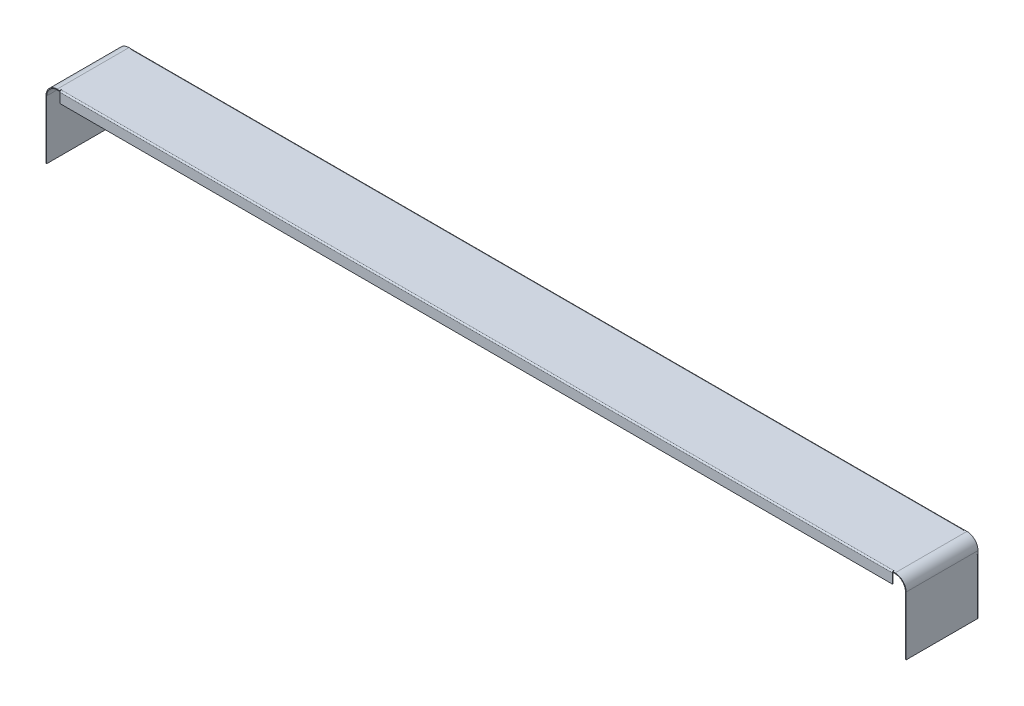
from build123d import *

# Parameters (mm, degrees)
BASE_FLANGE1_DEPTH            = 104
EDGE_FLANGE1_STRIP_W          = 6
EDGE_FLANGE1_STRIP_H          = 1
EDGE_FLANGE1_STRIP_CUT_DEPTH  = 1204
EDGE_FLANGE1_RELIEF_W         = 6.5
EDGE_FLANGE1_RELIEF_H         = 0.5
EDGE_FLANGE1_RELIEF_CUT_DEPTH = 1
EDGE_FLANGE1_DEPTH            = 1204
EDGE_FLANGE2_STRIP_W          = 6
EDGE_FLANGE2_STRIP_H          = 1
EDGE_FLANGE2_STRIP_CUT_DEPTH  = 1204
EDGE_FLANGE2_DEPTH            = 1204
EDGE_FLANGE3_STRIP_W          = 6
EDGE_FLANGE3_STRIP_H          = 1
EDGE_FLANGE3_STRIP_CUT_DEPTH  = 80
EDGE_FLANGE3_RELIEF_W         = 6.5
EDGE_FLANGE3_RELIEF_H         = 0.5
EDGE_FLANGE3_RELIEF_CUT_DEPTH = 1
EDGE_FLANGE3_DEPTH            = 80
EDGE_FLANGE4_STRIP_W          = 6
EDGE_FLANGE4_STRIP_H          = 1
EDGE_FLANGE4_STRIP_CUT_DEPTH  = 80
EDGE_FLANGE4_DEPTH            = 80
EDGE_FLANGE5_STRIP_W          = 6
EDGE_FLANGE5_STRIP_H          = 1
EDGE_FLANGE5_STRIP_CUT_DEPTH  = 1204
EDGE_FLANGE5_RELIEF_W         = 6.5
EDGE_FLANGE5_RELIEF_H         = 0.5
EDGE_FLANGE5_RELIEF_CUT_DEPTH = 1
EDGE_FLANGE5_DEPTH            = 1204


# Sheet-metal steps are written as plain solids
with BuildPart() as part:
    # Sketch1 → Base-Flange1 (new body)
    with BuildSketch(Plane.XY):
        with BuildLine():
            Line((-621, -100), (-621, -15))
            ThreePointArc((-621, -15), (-616.606601718, -4.393398282), (-606, 0))
            Line((-606, 0), (606, 0))
            ThreePointArc((606, 0), (616.606601718, -4.393398282), (621, -15))
            Line((621, -15), (621, -100))
            Line((621, -100), (622, -100))
            Line((622, -100), (622, -15))
            ThreePointArc((622, -15), (617.313708499, -3.686291501), (606, 1))
            Line((606, 1), (-606, 1))
            ThreePointArc((-606, 1), (-617.313708499, -3.686291501), (-622, -15))
            Line((-622, -15), (-622, -100))
            Line((-622, -100), (-621, -100))
        make_face()
    extrude(amount=BASE_FLANGE1_DEPTH)

    # Edge-Flange1 strip (across the edge) → Edge-Flange1 strip cut (cut)
    with BuildSketch(Plane(origin=(-602, 0, 0), x_dir=(0, 0, 1), z_dir=(1, 0, 0))):
        with Locations((-2, -0.5)):
            Rectangle(EDGE_FLANGE1_STRIP_W, EDGE_FLANGE1_STRIP_H)
    extrude(amount=EDGE_FLANGE1_STRIP_CUT_DEPTH, mode=Mode.SUBTRACT)

    # Edge-Flange1 relief (on the sheet) → Edge-Flange1 relief cut (cut)
    with BuildSketch(Plane(origin=(-602, 0, 1), x_dir=(0, 0, 1), z_dir=(0, -1, 0))):
        with Locations((-2.75, 0.25)):
            Rectangle(EDGE_FLANGE1_RELIEF_W, EDGE_FLANGE1_RELIEF_H)
        with Locations((-2.75, -1204.25)):
            Rectangle(EDGE_FLANGE1_RELIEF_W, EDGE_FLANGE1_RELIEF_H)
    extrude(amount=-EDGE_FLANGE1_RELIEF_CUT_DEPTH, mode=Mode.SUBTRACT)

    # Edge-Flange1 section (across the edge) → Edge-Flange1 (add)
    with BuildSketch(Plane(origin=(-602, 0, 0), x_dir=(0, 0, 1), z_dir=(1, 0, 0))):
        with BuildLine():
            Line((-1, 1), (-1, 19))
            Line((-1, 19), (0, 19))
            Line((0, 19), (0, 1))
            ThreePointArc((0, 1), (0.292893219, 0.292893219), (1, 0))
            Line((1, 0), (1, -1))
            ThreePointArc((1, -1), (-0.414213562, -0.414213562), (-1, 1))
        make_face()
    extrude(amount=EDGE_FLANGE1_DEPTH)

    # Edge-Flange2 strip (across the edge) → Edge-Flange2 strip cut (cut)
    with BuildSketch(Plane(origin=(-602, -19, 0), x_dir=(0, 1, 0), z_dir=(1, 0, 0))):
        with Locations((-1, -0.5)):
            Rectangle(EDGE_FLANGE2_STRIP_W, EDGE_FLANGE2_STRIP_H)
    extrude(amount=EDGE_FLANGE2_STRIP_CUT_DEPTH, mode=Mode.SUBTRACT)

    # Edge-Flange2 section (across the edge) → Edge-Flange2 (add)
    with BuildSketch(Plane(origin=(-602, -19, 0), x_dir=(0, 1, 0), z_dir=(1, 0, 0))):
        with BuildLine():
            Line((0, 1), (0, 12))
            Line((0, 12), (1, 12))
            Line((1, 12), (1, 1))
            ThreePointArc((1, 1), (1.292893219, 0.292893219), (2, 0))
            Line((2, 0), (2, -1))
            ThreePointArc((2, -1), (0.585786438, -0.414213562), (0, 1))
        make_face()
    extrude(amount=EDGE_FLANGE2_DEPTH)

    # Edge-Flange3 strip (across the edge) → Edge-Flange3 strip cut (cut)
    with BuildSketch(Plane(origin=(-621, -100, 0), x_dir=(0, 0, 1), z_dir=(0, 1, 0))):
        with Locations((-2, -0.5)):
            Rectangle(EDGE_FLANGE3_STRIP_W, EDGE_FLANGE3_STRIP_H)
    edge_flange3_strip_cut = extrude(amount=EDGE_FLANGE3_STRIP_CUT_DEPTH, mode=Mode.SUBTRACT)

    # Edge-Flange3 relief (on the sheet) → Edge-Flange3 relief cut (cut)
    with BuildSketch(Plane(origin=(-621, -100, 1), x_dir=(0, 0, 1), z_dir=(1, 0, 0))):
        with Locations((-2.75, -80.25)):
            Rectangle(EDGE_FLANGE3_RELIEF_W, EDGE_FLANGE3_RELIEF_H)
    edge_flange3_relief_cut = extrude(amount=-EDGE_FLANGE3_RELIEF_CUT_DEPTH, mode=Mode.SUBTRACT)

    # Edge-Flange3 section (across the edge) → Edge-Flange3 (add)
    with BuildSketch(Plane(origin=(-621, -100, 0), x_dir=(0, 0, 1), z_dir=(0, 1, 0))):
        with BuildLine():
            Line((-1, 1), (-1, 19))
            Line((-1, 19), (0, 19))
            Line((0, 19), (0, 1))
            ThreePointArc((0, 1), (0.292893219, 0.292893219), (1, 0))
            Line((1, 0), (1, -1))
            ThreePointArc((1, -1), (-0.414213562, -0.414213562), (-1, 1))
        make_face()
    edge_flange3 = extrude(amount=EDGE_FLANGE3_DEPTH)

    # Edge-Flange4 strip (across the edge) → Edge-Flange4 strip cut (cut)
    with BuildSketch(Plane(origin=(-602, -100, 0), x_dir=(-1, 0, 0), z_dir=(0, 1, 0))):
        with Locations((-1, -0.5)):
            Rectangle(EDGE_FLANGE4_STRIP_W, EDGE_FLANGE4_STRIP_H)
    edge_flange4_strip_cut = extrude(amount=EDGE_FLANGE4_STRIP_CUT_DEPTH, mode=Mode.SUBTRACT)

    # Edge-Flange4 section (across the edge) → Edge-Flange4 (add)
    with BuildSketch(Plane(origin=(-602, -100, 0), x_dir=(-1, 0, 0), z_dir=(0, 1, 0))):
        with BuildLine():
            Line((0, 1), (0, 12))
            Line((0, 12), (1, 12))
            Line((1, 12), (1, 1))
            ThreePointArc((1, 1), (1.292893219, 0.292893219), (2, 0))
            Line((2, 0), (2, -1))
            ThreePointArc((2, -1), (0.585786438, -0.414213562), (0, 1))
        make_face()
    edge_flange4 = extrude(amount=EDGE_FLANGE4_DEPTH)

    # Mirror1: Edge-Flange3 strip cut, Edge-Flange3 relief cut, Edge-Flange3, Edge-Flange4 strip cut, Edge-Flange4 across plane
    add(edge_flange3_strip_cut.mirror(Plane(origin=(0, 0, 0), x_dir=(0, 0, 1), z_dir=(1, 0, 0))), mode=Mode.SUBTRACT)
    add(edge_flange3_relief_cut.mirror(Plane(origin=(0, 0, 0), x_dir=(0, 0, 1), z_dir=(1, 0, 0))), mode=Mode.SUBTRACT)
    add(edge_flange3.mirror(Plane(origin=(0, 0, 0), x_dir=(0, 0, 1), z_dir=(1, 0, 0))))
    add(edge_flange4_strip_cut.mirror(Plane(origin=(0, 0, 0), x_dir=(0, 0, 1), z_dir=(1, 0, 0))), mode=Mode.SUBTRACT)
    add(edge_flange4.mirror(Plane(origin=(0, 0, 0), x_dir=(0, 0, 1), z_dir=(1, 0, 0))))

    # Edge-Flange5 strip (across the edge) → Edge-Flange5 strip cut (cut)
    with BuildSketch(Plane(origin=(602, 0, 104), x_dir=(0, 0, -1), z_dir=(-1, 0, 0))):
        with Locations((-1, -0.5)):
            Rectangle(EDGE_FLANGE5_STRIP_W, EDGE_FLANGE5_STRIP_H)
    extrude(amount=EDGE_FLANGE5_STRIP_CUT_DEPTH, mode=Mode.SUBTRACT)

    # Edge-Flange5 relief (on the sheet) → Edge-Flange5 relief cut (cut)
    with BuildSketch(Plane(origin=(602, 0, 102), x_dir=(0, 0, -1), z_dir=(0, -1, 0))):
        with Locations((-2.75, 0.25)):
            Rectangle(EDGE_FLANGE5_RELIEF_W, EDGE_FLANGE5_RELIEF_H)
        with Locations((-2.75, -1204.25)):
            Rectangle(EDGE_FLANGE5_RELIEF_W, EDGE_FLANGE5_RELIEF_H)
    extrude(amount=-EDGE_FLANGE5_RELIEF_CUT_DEPTH, mode=Mode.SUBTRACT)

    # Edge-Flange5 section (across the edge) → Edge-Flange5 (add)
    with BuildSketch(Plane(origin=(602, 0, 104), x_dir=(0, 0, -1), z_dir=(-1, 0, 0))):
        with BuildLine():
            Line((0, 1), (0, 15))
            Line((0, 15), (1, 15))
            Line((1, 15), (1, 1))
            ThreePointArc((1, 1), (1.292893219, 0.292893219), (2, 0))
            Line((2, 0), (2, -1))
            ThreePointArc((2, -1), (0.585786438, -0.414213562), (0, 1))
        make_face()
    extrude(amount=EDGE_FLANGE5_DEPTH)


solid = part.part
